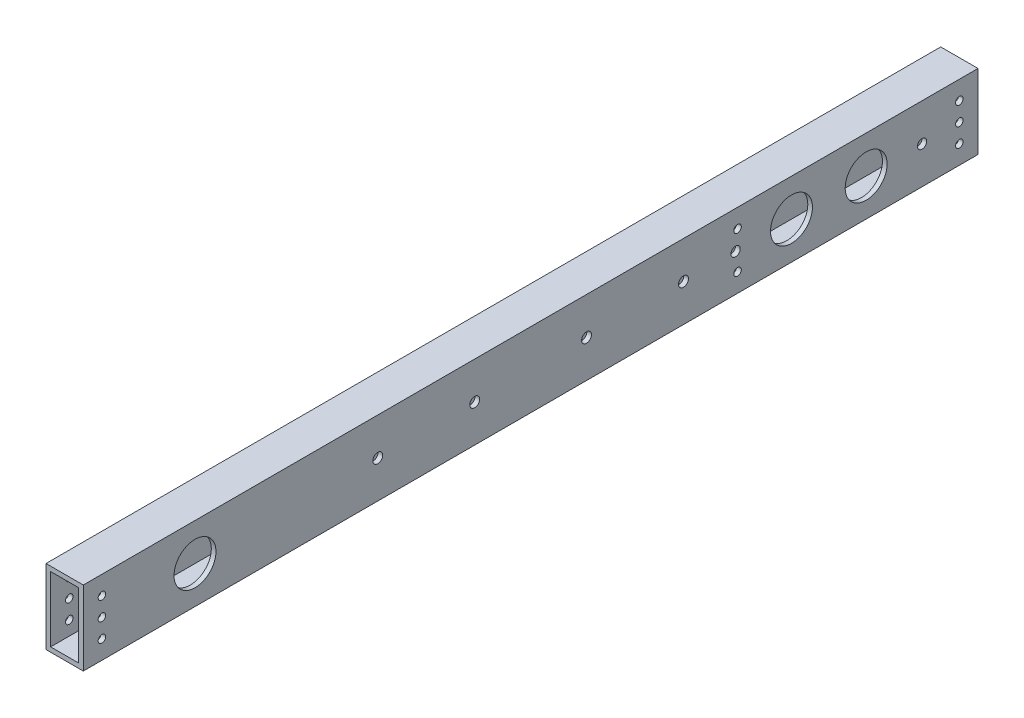
from build123d import *

# Parameters (mm, degrees)
SKETCH1_W               = 25.4
SKETCH1_H               = 50.8
SKETCH1_W_2             = 19.05
SKETCH1_H_2             = 44.45
BOSS_EXTRUDE1_DEPTH     = 304.8
F_10_CLEARANCE_HOLE1_D  = 5.1054
F_1_4_CLEARANCE_HOLE2_D = 6.7564
SKETCH7_R               = 14.2875
SKETCH7_R_2             = 3.175
CUT_EXTRUDE1_DEPTH      = 307.909367729
SKETCH8_R               = 2.5527
CUT_EXTRUDE2_DEPTH      = 307.909367729


with BuildPart() as part:
    # Sketch1 → Boss-Extrude1 (new, symmetric)
    with BuildSketch(Plane.XY):
        Rectangle(SKETCH1_W, SKETCH1_H)
        Rectangle(SKETCH1_W_2, SKETCH1_H_2, mode=Mode.SUBTRACT)
    extrude(amount=BOSS_EXTRUDE1_DEPTH, both=True)

    # #10 Clearance Hole1 (through all)
    with Locations(Plane(origin=(12.7, 0, 0), x_dir=(0, 0, -1), z_dir=(1, 0, 0))):
        with Locations((-292.1, 12.7), (-292.1, 0), (-292.1, -12.7)):
            f_10_clearance_hole1 = Hole(F_10_CLEARANCE_HOLE1_D / 2)

    # Mirror1: #10 Clearance Hole1 across plane
    add(f_10_clearance_hole1.mirror(Plane.XY), mode=Mode.SUBTRACT)

    # 1/4 Clearance Hole2 (through all)
    with Locations(Plane(origin=(12.7, 0, 0), x_dir=(0, 0, -1), z_dir=(1, 0, 0))):
        with Locations((-38.1, 0), (38.1, 0), (-104.14, 0), (104.14, 0)):
            Hole(F_1_4_CLEARANCE_HOLE2_D / 2)

    # Sketch7 → Cut-Extrude1 (cut, through all)
    with BuildSketch(Plane(origin=(12.7, 0, 0), x_dir=(0, 0, -1), z_dir=(1, 0, 0))):
        with Locations((-228.6762, 0)):
            Circle(SKETCH7_R)
        with Locations((177.7238, 0)):
            Circle(SKETCH7_R)
        with Locations((228.6, 0)):
            Circle(SKETCH7_R)
        with Locations((139.6238, 0)):
            Circle(SKETCH7_R_2)
        with Locations((266.7, 0)):
            Circle(SKETCH7_R_2)
    extrude(amount=-CUT_EXTRUDE1_DEPTH, mode=Mode.SUBTRACT)

    # Sketch8 → Cut-Extrude2 (cut, through all)
    with BuildSketch(Plane(origin=(12.7, 0, 0), x_dir=(0, 0, -1), z_dir=(1, 0, 0))):
        with Locations((140.97, 12.7)):
            Circle(SKETCH8_R)
        with Locations((140.97, -12.7)):
            Circle(SKETCH8_R)
    extrude(amount=-CUT_EXTRUDE2_DEPTH, mode=Mode.SUBTRACT)


solid = part.part
